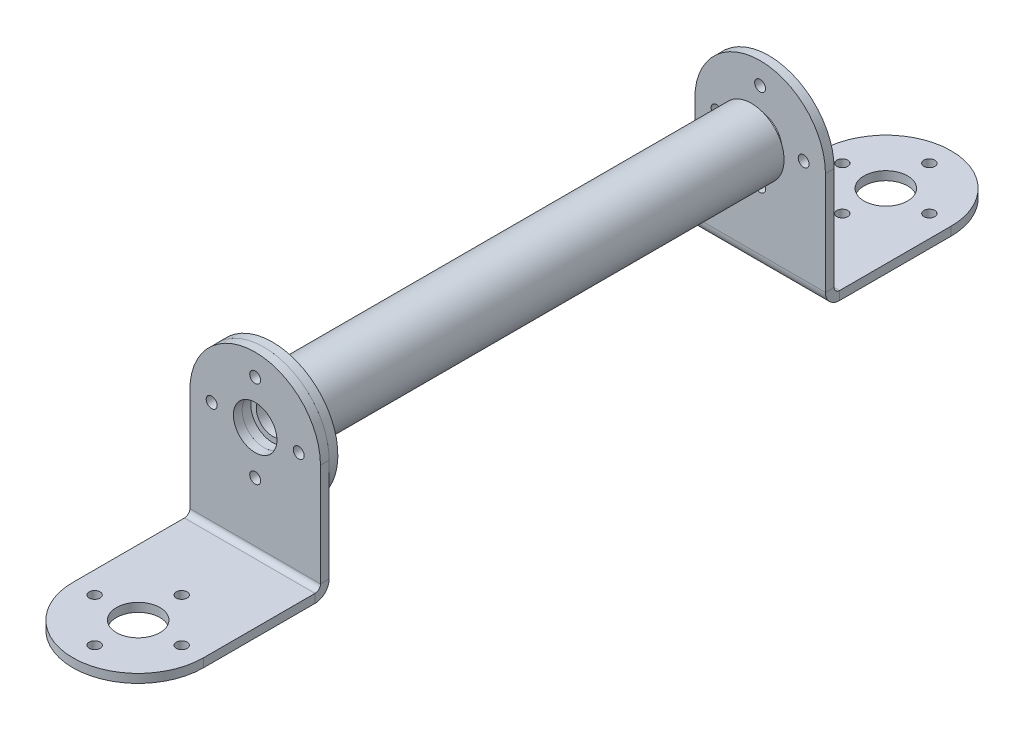
from build123d import *

# Parameters (mm, degrees)
SKETCH1_R                    = 4
SKETCH1_R_2                  = 1
BASE_FLANGE1_DEPTH           = 1.6
EDGE_FLANGE1_STRIP_W         = 8.4
EDGE_FLANGE1_STRIP_H         = 1.6
EDGE_FLANGE1_STRIP_CUT_DEPTH = 24
EDGE_FLANGE1_DEPTH           = 24
CUT_EXTRUDE1_REACH           = 49.79
SKETCH8_R                    = 4
SKETCH8_R_2                  = 1
SKETCH9_R                    = 12
SKETCH9_R_2                  = 1
SKETCH9_R_3                  = 4
BOSS_EXTRUDE1_DEPTH          = 1.6
SKETCH10_R                   = 6
SKETCH10_R_2                 = 3
BOSS_EXTRUDE2_DEPTH          = 88


# Sheet-metal steps are written as plain solids
with BuildPart() as part:
    # Sketch1 → Base-Flange1 (new body)
    with BuildSketch(Plane(origin=(0, 0, 0), x_dir=(1, 0, 0), z_dir=(0, 1, 0))):
        with BuildLine():
            Line((-12, 0), (-12, 21.5))
            Line((-12, 21.5), (12, 21.5))
            Line((12, 21.5), (12, 0))
            ThreePointArc((12, 0), (0, -12), (-12, 0))
        make_face()
        with Locations(Location((0, 0, 0), (0, 0, 270))):
            Circle(SKETCH1_R, mode=Mode.SUBTRACT)
        with Locations(Location((8, 0, 0), (0, 0, 270))):
            Circle(SKETCH1_R_2, mode=Mode.SUBTRACT)
        with Locations(Location((0, -8, 0), (0, 0, 270))):
            Circle(SKETCH1_R_2, mode=Mode.SUBTRACT)
        with Locations(Location((-8, 0, 0), (0, 0, 270))):
            Circle(SKETCH1_R_2, mode=Mode.SUBTRACT)
        with Locations(Location((0, 8, 0), (0, 0, 270))):
            Circle(SKETCH1_R_2, mode=Mode.SUBTRACT)
    extrude(amount=-BASE_FLANGE1_DEPTH)

    # Edge-Flange1 strip (across the edge) → Edge-Flange1 strip cut (cut)
    with BuildSketch(Plane(origin=(12, 0, -21.5), x_dir=(0, 0, 1), z_dir=(-1, 0, 0))):
        with Locations((-3.2, -0.8)):
            Rectangle(EDGE_FLANGE1_STRIP_W, EDGE_FLANGE1_STRIP_H)
    extrude(amount=EDGE_FLANGE1_STRIP_CUT_DEPTH, mode=Mode.SUBTRACT)

    # Edge-Flange1 section (across the edge) → Edge-Flange1 (add)
    with BuildSketch(Plane(origin=(12, 0, -21.5), x_dir=(0, 0, 1), z_dir=(-1, 0, 0))):
        with BuildLine():
            Line((-1.6, 1), (-1.6, 31.9))
            Line((-1.6, 31.9), (0, 31.9))
            Line((0, 31.9), (0, 1))
            ThreePointArc((0, 1), (0.292893219, 0.292893219), (1, 0))
            Line((1, 0), (1, -1.6))
            ThreePointArc((1, -1.6), (-0.838477631, -0.838477631), (-1.6, 1))
        make_face()
    extrude(amount=EDGE_FLANGE1_DEPTH)

    # Sketch8 → Cut-Extrude1 (cut, up to next)
    with BuildSketch(Plane.XY.offset(-21.5), mode=Mode.PRIVATE) as cut_extrude1_sk1:
        with BuildLine():
            Line((-12, 31.9), (-12, 19.9))
            ThreePointArc((-12, 19.9), (-8.485281374, 28.385281374), (0, 31.9))
            Line((0, 31.9), (-12, 31.9))
        make_face()
    cut_extrude1_tool1 = extrude(cut_extrude1_sk1.sketch, amount=-CUT_EXTRUDE1_REACH, mode=Mode.PRIVATE) & part.part
    # Sketch8 → Cut-Extrude1 (cut, up to next)
    with BuildSketch(Plane.XY.offset(-21.5), mode=Mode.PRIVATE) as cut_extrude1_sk2:
        with BuildLine():
            Line((12, 31.9), (0, 31.9))
            ThreePointArc((0, 31.9), (8.485281374, 28.385281374), (12, 19.9))
            Line((12, 19.9), (12, 31.9))
        make_face()
    cut_extrude1_tool2 = extrude(cut_extrude1_sk2.sketch, amount=-CUT_EXTRUDE1_REACH, mode=Mode.PRIVATE) & part.part
    # Sketch8 → Cut-Extrude1 (cut, up to next)
    with BuildSketch(Plane.XY.offset(-21.5), mode=Mode.PRIVATE) as cut_extrude1_sk3:
        with Locations((0, 19.9)):
            Circle(SKETCH8_R)
    cut_extrude1_tool3 = extrude(cut_extrude1_sk3.sketch, amount=-CUT_EXTRUDE1_REACH, mode=Mode.PRIVATE) & part.part
    # Sketch8 → Cut-Extrude1 (cut, up to next)
    with BuildSketch(Plane.XY.offset(-21.5), mode=Mode.PRIVATE) as cut_extrude1_sk4:
        with Locations((-8, 19.9)):
            Circle(SKETCH8_R_2)
    cut_extrude1_tool4 = extrude(cut_extrude1_sk4.sketch, amount=-CUT_EXTRUDE1_REACH, mode=Mode.PRIVATE) & part.part
    # Sketch8 → Cut-Extrude1 (cut, up to next)
    with BuildSketch(Plane.XY.offset(-21.5), mode=Mode.PRIVATE) as cut_extrude1_sk5:
        with Locations((0, 27.9)):
            Circle(SKETCH8_R_2)
    cut_extrude1_tool5 = extrude(cut_extrude1_sk5.sketch, amount=-CUT_EXTRUDE1_REACH, mode=Mode.PRIVATE) & part.part
    # Sketch8 → Cut-Extrude1 (cut, up to next)
    with BuildSketch(Plane.XY.offset(-21.5), mode=Mode.PRIVATE) as cut_extrude1_sk6:
        with Locations((8, 19.9)):
            Circle(SKETCH8_R_2)
    cut_extrude1_tool6 = extrude(cut_extrude1_sk6.sketch, amount=-CUT_EXTRUDE1_REACH, mode=Mode.PRIVATE) & part.part
    # Sketch8 → Cut-Extrude1 (cut, up to next)
    with BuildSketch(Plane.XY.offset(-21.5), mode=Mode.PRIVATE) as cut_extrude1_sk7:
        with Locations((0, 11.9)):
            Circle(SKETCH8_R_2)
    cut_extrude1_tool7 = extrude(cut_extrude1_sk7.sketch, amount=-CUT_EXTRUDE1_REACH, mode=Mode.PRIVATE) & part.part
    add(cut_extrude1_tool1.solids().sort_by_distance((-9.319585, 29.219585, -21.5))[0], mode=Mode.SUBTRACT)
    add(cut_extrude1_tool2.solids().sort_by_distance((9.319585, 29.219585, -21.5))[0], mode=Mode.SUBTRACT)
    add(cut_extrude1_tool3.solids().sort_by_distance((0, 19.9, -21.5))[0], mode=Mode.SUBTRACT)
    add(cut_extrude1_tool4.solids().sort_by_distance((-8, 19.9, -21.5))[0], mode=Mode.SUBTRACT)
    add(cut_extrude1_tool5.solids().sort_by_distance((0, 27.9, -21.5))[0], mode=Mode.SUBTRACT)
    add(cut_extrude1_tool6.solids().sort_by_distance((8, 19.9, -21.5))[0], mode=Mode.SUBTRACT)
    add(cut_extrude1_tool7.solids().sort_by_distance((0, 11.9, -21.5))[0], mode=Mode.SUBTRACT)


with BuildPart() as body_2:
    # Sketch9 → Boss-Extrude1 (new body)
    with BuildSketch(Plane(origin=(0, 0, -23.1), x_dir=(-1, 0, 0), z_dir=(0, 0, -1))):
        with Locations(Location((0, 19.9, 0), (0, 0, 90))):
            Circle(SKETCH9_R)
        with Locations(Location((0, 27.9, 0), (0, 0, 90))):
            Circle(SKETCH9_R_2, mode=Mode.SUBTRACT)
        with Locations(Location((8, 19.9, 0), (0, 0, 90))):
            Circle(SKETCH9_R_2, mode=Mode.SUBTRACT)
        with Locations(Location((0, 19.9, 0), (0, 0, 90))):
            Circle(SKETCH9_R_3, mode=Mode.SUBTRACT)
        with Locations(Location((-8, 19.9, 0), (0, 0, 90))):
            Circle(SKETCH9_R_2, mode=Mode.SUBTRACT)
        with Locations(Location((0, 11.9, 0), (0, 0, 90))):
            Circle(SKETCH9_R_2, mode=Mode.SUBTRACT)
    extrude(amount=BOSS_EXTRUDE1_DEPTH)

    # Sketch10 → Boss-Extrude2 (add)
    with BuildSketch(Plane(origin=(0, 0, -24.7), x_dir=(-1, 0, 0), z_dir=(0, 0, -1))):
        with Locations(Location((0, 19.9, 0), (0, 0, 90))):
            Circle(SKETCH10_R)
        with Locations(Location((0, 19.9, 0), (0, 0, 90))):
            Circle(SKETCH10_R_2, mode=Mode.SUBTRACT)
    extrude(amount=BOSS_EXTRUDE2_DEPTH)


with BuildPart() as body_3:
    # Mirror1: mirrored copy
    add(part.part.mirror(Plane(origin=(0, 0, -68.7), x_dir=(1, 0, 0), z_dir=(0, 0, -1))))


solid = Compound([part.part, body_2.part, body_3.part])
